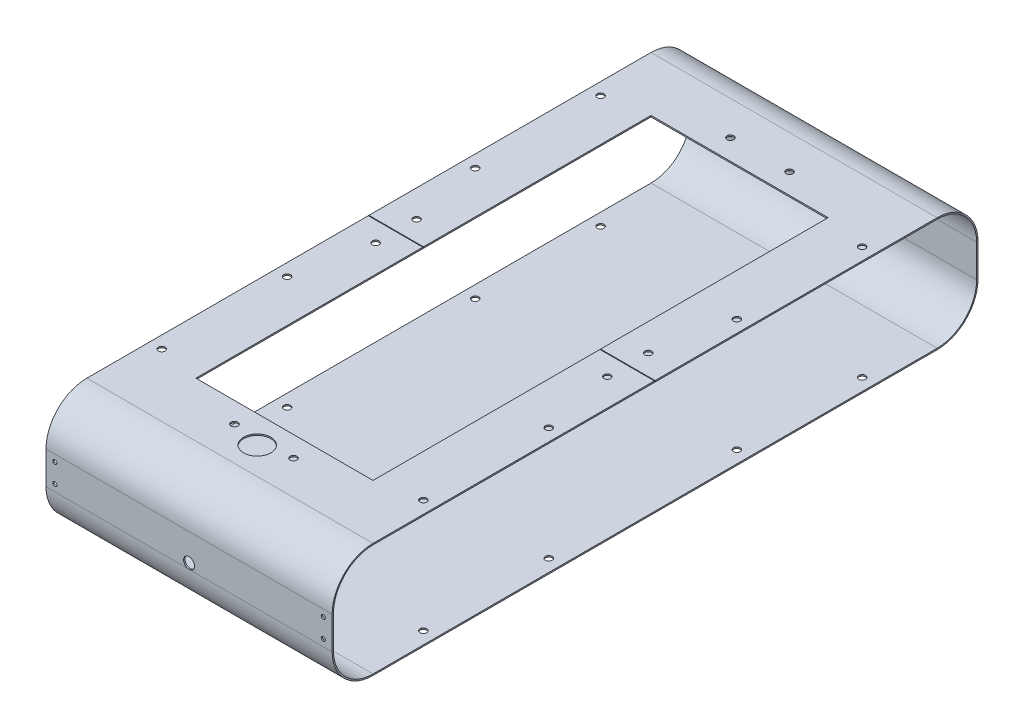
from build123d import *

# Parameters (mm, degrees)
SALIENTE_EXTRUIR1_DEPTH = 110
VACIADO2_T              = -1
CORTAR_EXTRUIR1_START   = -10
CORTAR_EXTRUIR1_DEPTH   = 10
CROQUIS8_R              = 1.5
CORTAR_EXTRUIR4_DEPTH   = 5
CROQUIS9_R              = 4
CORTAR_EXTRUIR5_DEPTH   = 5
CROQUIS10_R             = 2.5
CORTAR_EXTRUIR6_DEPTH   = 275.454003432
CROQUIS11_W             = 130
CROQUIS11_H             = 334
CORTAR_EXTRUIR7_DEPTH   = 8
CROQUIS12_R             = 2.5
CORTAR_EXTRUIR8_DEPTH   = 8
CROQUIS13_W             = 40
CROQUIS13_H             = 0.5
CORTAR_EXTRUIR9_DEPTH   = 1
CROQUIS14_R             = 2.5
CORTAR_EXTRUIR10_DEPTH  = 1
CROQUIS16_R             = 10
CORTAR_EXTRUIR11_DEPTH  = 10


with BuildPart() as part:
    # Croquis1 → Saliente-Extruir1 (new, symmetric)
    with BuildSketch(Plane(origin=(0, 0, 0), x_dir=(0, 0, -1), z_dir=(1, 0, 0))):
        with BuildLine():
            Line((207, -42), (-207, -42))
            ThreePointArc((-207, -42), (-228.213203436, -33.213203436), (-237, -12))
            Line((-237, -12), (-237, 12))
            ThreePointArc((-237, 12), (-228.213203436, 33.213203436), (-207, 42))
            Line((-207, 42), (207, 42))
            ThreePointArc((207, 42), (228.213203436, 33.213203436), (237, 12))
            Line((237, 12), (237, -12))
            ThreePointArc((237, -12), (228.213203436, -33.213203436), (207, -42))
        make_face()
    extrude(amount=SALIENTE_EXTRUIR1_DEPTH, both=True)

    # Vaciado2
    vaciado2_openings = [part.faces().sort_by_distance(p)[0] for p in [
        (110, 0, 0),
    ]]
    offset(amount=VACIADO2_T, openings=vaciado2_openings, kind=Kind.INTERSECTION)

    # Croquis6 → Cortar-Extruir1 (cut)
    with BuildSketch(Plane.ZY.offset(110).offset(CORTAR_EXTRUIR1_START)):
        with BuildLine():
            Line((207, 42), (-207, 42))
            ThreePointArc((-207, 42), (-228.213203436, 33.213203436), (-237, 12))
            Line((-237, 12), (-237, -12))
            ThreePointArc((-237, -12), (-228.213203436, -33.213203436), (-207, -42))
            Line((-207, -42), (207, -42))
            ThreePointArc((207, -42), (228.213203436, -33.213203436), (237, -12))
            Line((237, -12), (237, 12))
            ThreePointArc((237, 12), (228.213203436, 33.213203436), (207, 42))
        make_face()
    extrude(amount=CORTAR_EXTRUIR1_DEPTH, mode=Mode.SUBTRACT)

    # Croquis8 → Cortar-Extruir4 (cut)
    with BuildSketch(Plane.XY.offset(237)):
        with Locations((103.5, 7)):
            Circle(CROQUIS8_R)
        with Locations((103.5, -7)):
            Circle(CROQUIS8_R)
        with Locations((-93.5, -7)):
            Circle(CROQUIS8_R)
        with Locations((-93.5, 7)):
            Circle(CROQUIS8_R)
    extrude(amount=-CORTAR_EXTRUIR4_DEPTH, mode=Mode.SUBTRACT)

    # Croquis9 → Cortar-Extruir5 (cut)
    with BuildSketch(Plane.XY.offset(237)):
        with Locations((5, -8)):
            Circle(CROQUIS9_R)
    extrude(amount=-CORTAR_EXTRUIR5_DEPTH, mode=Mode.SUBTRACT)

    # Croquis10 → Cortar-Extruir6 (cut, through all)
    with BuildSketch(Plane(origin=(0, 42, 0), x_dir=(1, 0, 0), z_dir=(0, 1, 0))):
        with Locations((101, 161.01)):
            Circle(CROQUIS10_R)
        with Locations((101, 69.01)):
            Circle(CROQUIS10_R)
        with Locations((-91, 69.01)):
            Circle(CROQUIS10_R)
        with Locations((-91, 161.01)):
            Circle(CROQUIS10_R)
        with Locations((101, -69.01)):
            Circle(CROQUIS10_R)
        with Locations((101, -161.01)):
            Circle(CROQUIS10_R)
        with Locations((-91, -161.01)):
            Circle(CROQUIS10_R)
        with Locations((-91, -69.01)):
            Circle(CROQUIS10_R)
    extrude(amount=-CORTAR_EXTRUIR6_DEPTH, mode=Mode.SUBTRACT)

    # Croquis11 → Cortar-Extruir7 (cut)
    with BuildSketch(Plane(origin=(0, 42, 0), x_dir=(1, 0, 0), z_dir=(0, 1, 0))):
        with Locations((5, 0)):
            Rectangle(CROQUIS11_W, CROQUIS11_H)
    extrude(amount=-CORTAR_EXTRUIR7_DEPTH, mode=Mode.SUBTRACT)

    # Croquis12 → Cortar-Extruir8 (cut)
    with BuildSketch(Plane(origin=(0, 42, 0), x_dir=(1, 0, 0), z_dir=(0, 1, 0))):
        with Locations((-16.666666667, 182)):
            Circle(CROQUIS12_R)
        with Locations((26.666666667, 182)):
            Circle(CROQUIS12_R)
        with Locations((26.666666667, -182)):
            Circle(CROQUIS12_R)
        with Locations((-16.666666667, -182)):
            Circle(CROQUIS12_R)
    extrude(amount=-CORTAR_EXTRUIR8_DEPTH, mode=Mode.SUBTRACT)

    # Croquis13 → Cortar-Extruir9 (cut)
    with BuildSketch(Plane(origin=(0, 42, 0), x_dir=(1, 0, 0), z_dir=(0, 1, 0))):
        with Locations((-80, -0.25)):
            Rectangle(CROQUIS13_W, CROQUIS13_H)
        with Locations((90, -0.25)):
            Rectangle(CROQUIS13_W, CROQUIS13_H)
    extrude(amount=-CORTAR_EXTRUIR9_DEPTH, mode=Mode.SUBTRACT)

    # Croquis14 → Cortar-Extruir10 (cut)
    with BuildSketch(Plane(origin=(0, 42, 0), x_dir=(1, 0, 0), z_dir=(0, 1, 0))):
        with Locations((90, 15)):
            Circle(CROQUIS14_R)
        with Locations((90, -15)):
            Circle(CROQUIS14_R)
        with Locations((-80, -15)):
            Circle(CROQUIS14_R)
        with Locations((-80, 15)):
            Circle(CROQUIS14_R)
    extrude(amount=-CORTAR_EXTRUIR10_DEPTH, mode=Mode.SUBTRACT)

    # Croquis16 → Cortar-Extruir11 (cut)
    with BuildSketch(Plane(origin=(0, 42, 0), x_dir=(1, 0, 0), z_dir=(0, 1, 0))):
        with Locations((5, -187)):
            Circle(CROQUIS16_R)
    extrude(amount=-CORTAR_EXTRUIR11_DEPTH, mode=Mode.SUBTRACT)


solid = part.part
